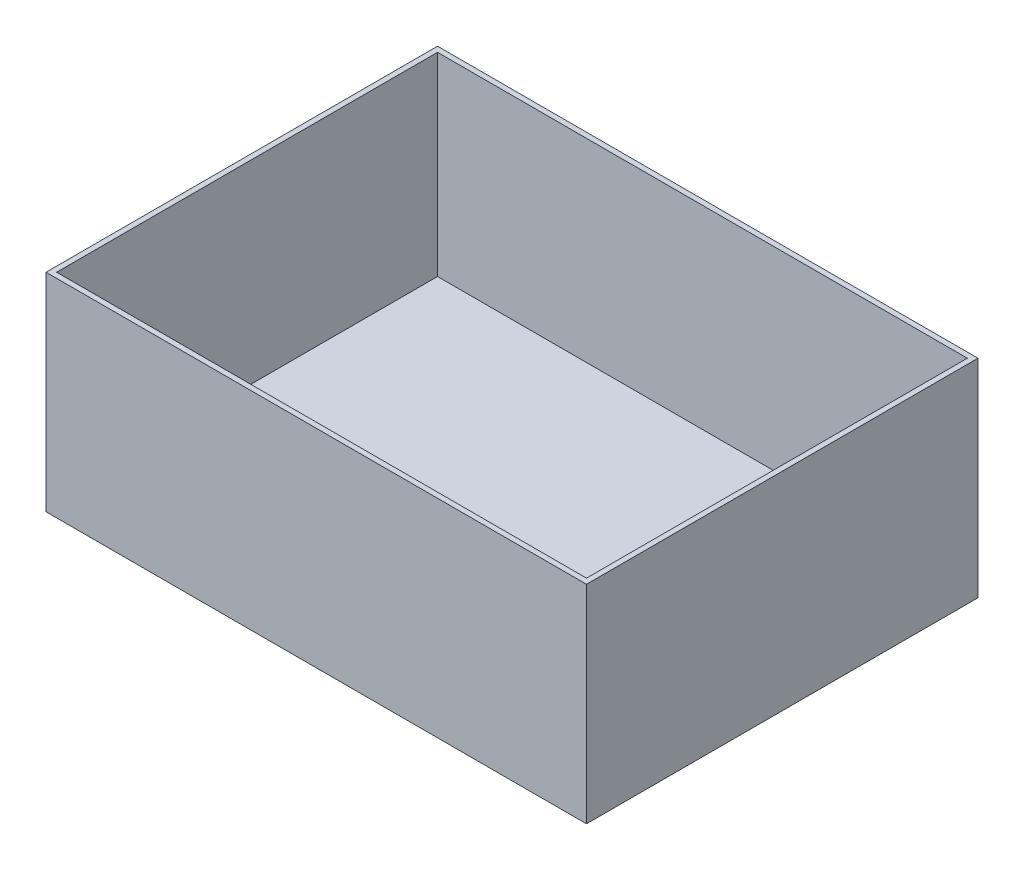
from build123d import *

# Parameters (mm, degrees)
SKETCH1_W           = 645.16
SKETCH1_H           = 467.36
BOSS_EXTRUDE1_DEPTH = 241.3
SHELL1_T            = -6.35
SKETCH2_W           = 645.16
SKETCH2_H           = 467.36
SKETCH2_W_2         = 632.46
SKETCH2_H_2         = 454.66
BOSS_EXTRUDE2_DEPTH = 6.35
SKETCH3_W           = 632.46
SKETCH3_H           = 454.66
BOSS_EXTRUDE3_DEPTH = 9.525


with BuildPart() as part:
    # Sketch1 → Boss-Extrude1 (new body)
    with BuildSketch(Plane(origin=(0, 0, 0), x_dir=(1, 0, 0), z_dir=(0, 1, 0))):
        with Locations((322.58, 233.68)):
            Rectangle(SKETCH1_W, SKETCH1_H)
    extrude(amount=BOSS_EXTRUDE1_DEPTH)

    # Shell1
    shell1_openings = [part.faces().sort_by_distance(p)[0] for p in [
        (322.58, 241.3, -233.68),
    ]]
    offset(amount=SHELL1_T, openings=shell1_openings, kind=Kind.INTERSECTION)

    # Sketch2 → Boss-Extrude2 (add)
    with BuildSketch(Plane(origin=(0, 241.3, 0), x_dir=(1, 0, 0), z_dir=(0, 1, 0))):
        with Locations((322.58, 233.68)):
            Rectangle(SKETCH2_W, SKETCH2_H)
        with Locations((322.58, 233.68)):
            Rectangle(SKETCH2_W_2, SKETCH2_H_2, mode=Mode.SUBTRACT)
    extrude(amount=BOSS_EXTRUDE2_DEPTH)

    # Sketch3 → Boss-Extrude3 (add)
    with BuildSketch(Plane(origin=(0, 6.35, 0), x_dir=(1, 0, 0), z_dir=(0, 1, 0))):
        with Locations((322.58, 233.68)):
            Rectangle(SKETCH3_W, SKETCH3_H)
    extrude(amount=BOSS_EXTRUDE3_DEPTH)


solid = part.part
